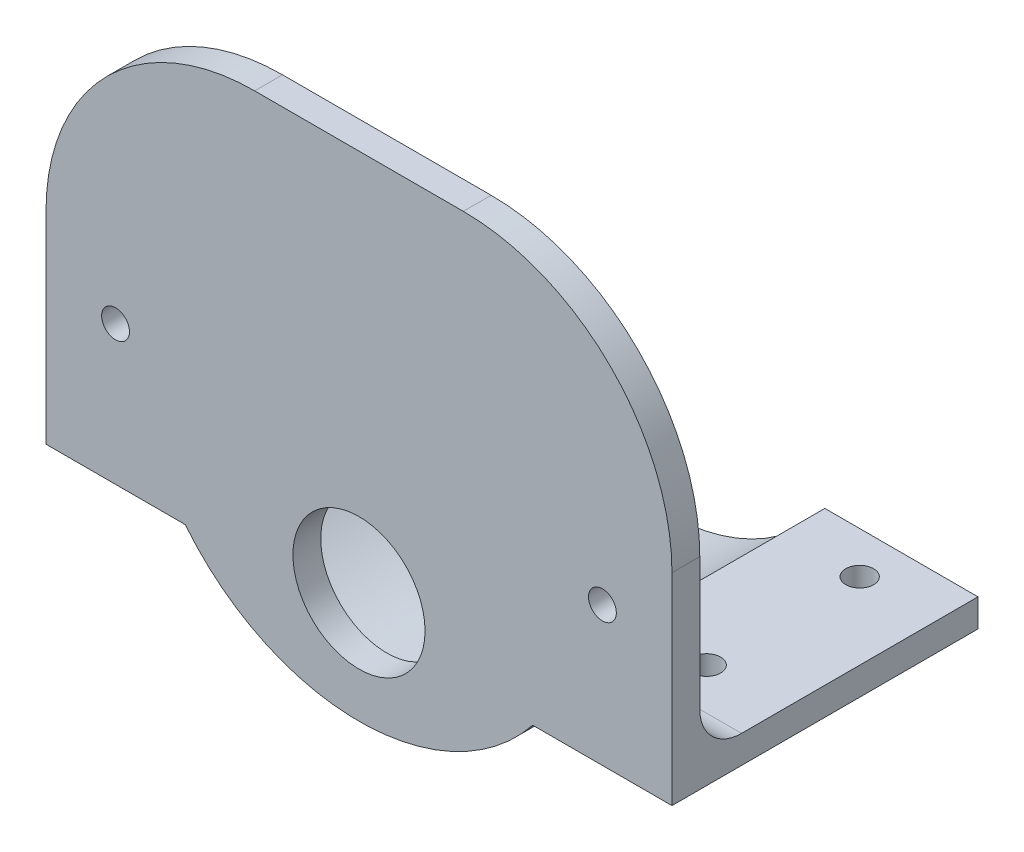
from build123d import *

# Parameters (mm, degrees)
SKETCH1_R           = 1
SKETCH1_R_2         = 4.75
BOSS_EXTRUDE2_DEPTH = 2
BOSS_EXTRUDE3_START = -22
BOSS_EXTRUDE3_DEPTH = 22
FILLET1_R           = 15
FILLET2_R           = 3
SKETCH3_R           = 1
CUT_EXTRUDE1_DEPTH  = 21


with BuildPart() as part:
    # Sketch1 → Boss-Extrude2 (new body)
    with BuildSketch(Plane.XY):
        with BuildLine():
            Line((-22.5, 19.5), (-22.5, -8))
            Line((-22.5, -8), (-11.489125293, -8))
            ThreePointArc((-11.489125293, -8), (0, -14), (11.489125293, -8))
            Line((11.489125293, -8), (22.5, -8))
            Line((22.5, -8), (22.5, 19.5))
            Line((22.5, 19.5), (-22.5, 19.5))
        make_face()
        with Locations((-17.5, 0)):
            Circle(SKETCH1_R, mode=Mode.SUBTRACT)
        with Locations((17.5, 0)):
            Circle(SKETCH1_R, mode=Mode.SUBTRACT)
        with Locations((0, -8)):
            Circle(SKETCH1_R_2, mode=Mode.SUBTRACT)
    extrude(amount=BOSS_EXTRUDE2_DEPTH)

    # Sketch2 → Boss-Extrude3 (add)
    with BuildSketch(Plane.XY.offset(2).offset(BOSS_EXTRUDE3_START)):
        with BuildLine():
            Line((-22.5, -8), (-22.5, -10))
            Line((-22.5, -10), (-12.489995997, -10))
            ThreePointArc((-12.489995997, -10), (0, -16), (12.489995997, -10))
            Line((12.489995997, -10), (22.5, -10))
            Line((22.5, -10), (22.5, -8))
            Line((22.5, -8), (11.489125293, -8))
            ThreePointArc((11.489125293, -8), (0, -14), (-11.489125293, -8))
            Line((-11.489125293, -8), (-22.5, -8))
        make_face()
    extrude(amount=BOSS_EXTRUDE3_DEPTH)

    # Fillet1
    fillet1_edges = [part.edges().sort_by_distance(p)[0] for p in [
        (22.5, 19.5, 1),
        (-22.5, 19.5, 1),
    ]]
    fillet(fillet1_edges, radius=FILLET1_R)

    # Fillet2
    fillet2_edges = [part.edges().sort_by_distance(p)[0] for p in [
        (16.994562647, -8, 0),
        (-16.994562647, -8, 0),
    ]]
    fillet(fillet2_edges, radius=FILLET2_R)

    # Sketch3 → Cut-Extrude1 (cut)
    with BuildSketch(Plane(origin=(0, -8, 0), x_dir=(1, 0, 0), z_dir=(0, 1, 0))):
        with Locations((-16.994562647, 6)):
            Circle(SKETCH3_R)
        with Locations((-16.994562647, 17)):
            Circle(SKETCH3_R)
        with Locations((16.994562647, 17)):
            Circle(SKETCH3_R)
        with Locations((16.994562647, 6)):
            Circle(SKETCH3_R)
    extrude(amount=-CUT_EXTRUDE1_DEPTH, mode=Mode.SUBTRACT)


solid = part.part
